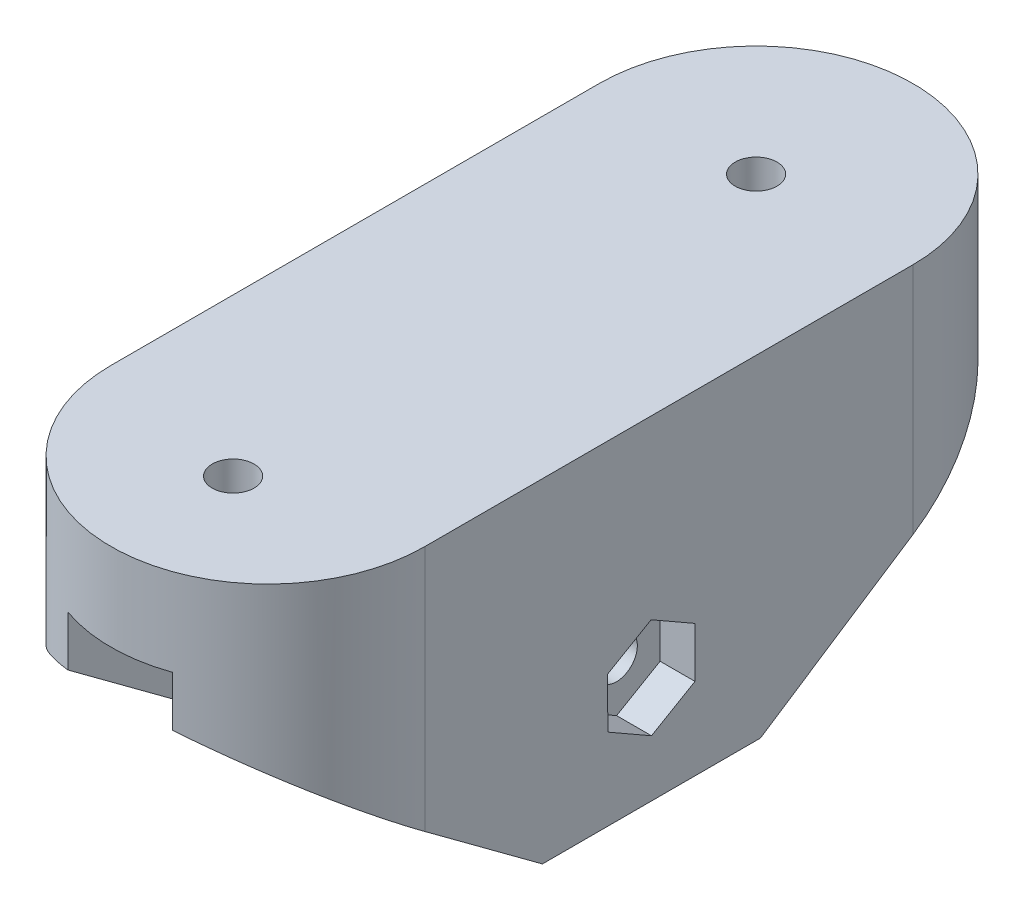
from build123d import *

# Parameters (mm, degrees)
BOSS_EXTRUDE1_DEPTH      = 6.35
BOSS_EXTRUDE3_DEPTH      = 11.43
BOSS_EXTRUDE3_DEPTH_BACK = 11.43
CUT_EXTRUDE13_DEPTH      = 55.124538916
CUT_EXTRUDE13_DEPTH_BACK = 55.124538916
SKETCH11_W               = 7.59470995
SKETCH11_H               = 29.201393096
CUT_EXTRUDE19_START      = -17.955569585
CUT_EXTRUDE19_DEPTH      = 17.955569585
SKETCH18_R               = 1.524
CUT_EXTRUDE22_DEPTH      = 58.631592142
CUT_EXTRUDE23_DEPTH      = 2.54
SKETCH22_R               = 1.524
CUT_EXTRUDE24_DEPTH      = 53.524026622
CUT_EXTRUDE25_DEPTH      = 2.54


# Read off the part's stored shape, not the designer's step: Cut-Extrude19
with BuildPart() as part:
    # Sketch1 → Boss-Extrude1 (new body)
    with BuildSketch(Plane(origin=(0, 0, 0), x_dir=(1, 0, 0), z_dir=(0, 1, 0))):
        with BuildLine():
            Line((11.43, 0), (11.43, -35.56))
            ThreePointArc((11.43, -35.56), (0, -46.99), (-11.43, -35.56))
            Line((-11.43, -35.56), (-11.43, 0))
            ThreePointArc((-11.43, 0), (0, 11.43), (11.43, 0))
        make_face()
    extrude(amount=-BOSS_EXTRUDE1_DEPTH)

    # Sketch2 → Boss-Extrude3 (add, two sides: drawn at the far end of the back side and taken through both)
    with BuildSketch(Plane(origin=(0, 0, 0), x_dir=(0, 0, -1), z_dir=(1, 0, 0)).offset(-BOSS_EXTRUDE3_DEPTH_BACK)):
        Polygon((-46.99, -6.35), (11.43, -6.35), (11.43, -9.525), (-11.11884122, -24.305569585), (-26.99384122, -24.305569585), (-46.99, -9.525), align=None)
    extrude(amount=BOSS_EXTRUDE3_DEPTH + BOSS_EXTRUDE3_DEPTH_BACK)

    # Sketch11 → Cut-Extrude13 (cut, two sides: drawn at the far end of the back side and taken through both)
    with BuildSketch(Plane.XY.offset(-CUT_EXTRUDE13_DEPTH_BACK)):
        with Locations((0.012645025, -20.950696548)):
            Rectangle(SKETCH11_W, SKETCH11_H)
    extrude(amount=CUT_EXTRUDE13_DEPTH + CUT_EXTRUDE13_DEPTH_BACK, mode=Mode.SUBTRACT)

    # Cut-Extrude19 outline → Cut-Extrude19 (cut)
    with BuildSketch(Plane(origin=(0, -6.35, 0), x_dir=(1, 0, 0), z_dir=(0, 1, 0)).offset(CUT_EXTRUDE19_START)):
        with BuildLine():
            Line((11.43, 11.43), (3.81, 11.43))
            Line((3.81, 11.43), (3.81, 10.776307345))
            ThreePointArc((3.81, 10.776307345), (9.33255592, 6.599113577), (11.43, 0))
            Line((11.43, 0), (11.43, 11.43))
        make_face()
        with BuildLine():
            ThreePointArc((11.43, -35.56), (9.332555866, -42.159113654), (3.809999822, -46.336307408))
            Line((3.809999822, -46.336307408), (3.81, -46.99))
            Line((3.81, -46.99), (11.43, -46.99))
            Line((11.43, -46.99), (11.43, -35.56))
        make_face()
        with BuildLine():
            ThreePointArc((-11.43, -5.66e-07), (-9.324809404, 6.610055188), (-3.78470995, 10.785215371))
            Line((-3.78470995, 10.785215371), (-3.78470995, 11.43))
            Line((-3.78470995, 11.43), (-11.43, 11.43))
            Line((-11.43, 11.43), (-11.43, -5.66e-07))
        make_face()
        with BuildLine():
            Line((-3.78470995, -46.99), (-3.784709773, -46.345215433))
            ThreePointArc((-3.784709773, -46.345215433), (-9.324809186, -42.170055495), (-11.43, -35.56))
            Line((-11.43, -35.56), (-11.43, -46.99))
            Line((-11.43, -46.99), (-3.78470995, -46.99))
        make_face()
    extrude(amount=CUT_EXTRUDE19_DEPTH, mode=Mode.SUBTRACT)

    # Sketch18 → Cut-Extrude22 (cut, through all)
    with BuildSketch(Plane.ZY.offset(11.43)):
        with Locations((19.062682441, -16.524127344)):
            Circle(SKETCH18_R)
    extrude(amount=-CUT_EXTRUDE22_DEPTH, mode=Mode.SUBTRACT)

    # Sketch20 → Cut-Extrude23 (cut)
    with BuildSketch(Plane.XZ.offset(6.35)):
        Polygon((0.016443108, 3.181298641), (-2.741372229, 1.60806008), (-2.757815336, -1.566897341), (-0.016443108, -3.1686162), (2.741372229, -1.595377639), (2.757815336, 1.579579782), align=None)
        Polygon((0.013747327, 34.440192786), (3.181851342, 36.285172538), (3.168104015, 39.951320972), (-0.013747327, 41.772489655), (-3.181851342, 39.927509903), (-3.168104015, 36.261361468), align=None)
    extrude(amount=-CUT_EXTRUDE23_DEPTH, mode=Mode.SUBTRACT)

    # Sketch22 → Cut-Extrude24 (cut, through all)
    with BuildSketch(Plane.XZ.offset(3.81)):
        with Locations(Location((0, 0, 0), (0, 0, 270))):
            Circle(SKETCH22_R)
        with Locations(Location((0, 38.094435686, 0), (0, 0, 270))):
            Circle(SKETCH22_R)
    extrude(amount=-CUT_EXTRUDE24_DEPTH, mode=Mode.SUBTRACT)

    # Sketch23 → Cut-Extrude25 (cut)
    with BuildSketch(Plane(origin=(11.43, 0, 0), x_dir=(0, 0, -1), z_dir=(1, 0, 0))):
        Polygon((-19.048935114, -20.190275778), (-15.880831099, -18.345296026), (-15.894578426, -14.679147592), (-19.076429768, -12.857978909), (-22.244533783, -14.702958661), (-22.230786456, -18.369107096), align=None)
    extrude(amount=-CUT_EXTRUDE25_DEPTH, mode=Mode.SUBTRACT)


solid = part.part
